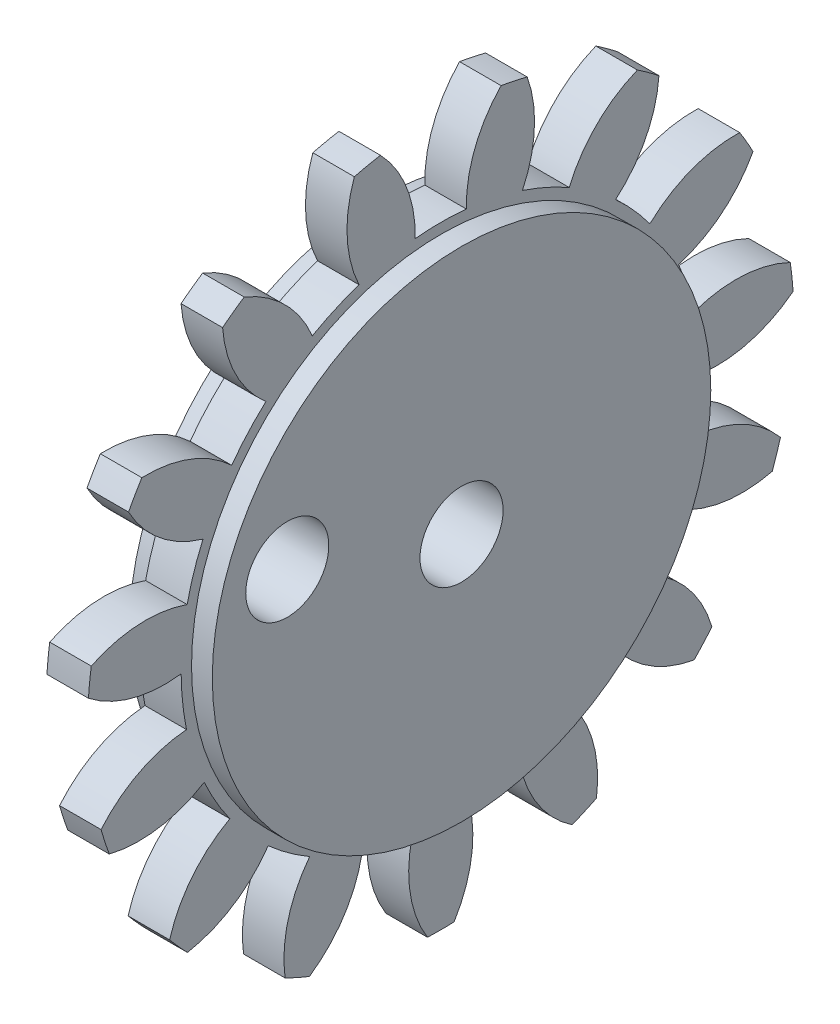
from build123d import *

# Parameters (mm, degrees)
BASPROSKE_W        = 6.35
BASPROSKE_H        = 53.975
TOOTHCUT_DEPTH     = 77.59584682
TEETHCUTS_COUNT    = 15
TEETHCUTS_ANGLE    = 336
HUBNEABOTSKE_R     = 38.1
HUBNEARBOTH_DEPTH  = 3.1750254
HUBFAR_START       = 3.1750254
HUBFARSKE_R        = 38.1
HUBFAR_DEPTH       = 3.1750254
BORSKE_R           = 6.35
BORE_DEPTH         = 12.7000508
SKETCH1_R          = 6.35
CUT_EXTRUDE1_DEPTH = 78.297193623
SCALE1_SCALE       = 0.75


with BuildPart() as part:
    # BasProSke → Base-Revolve (revolve)
    with BuildSketch(Plane(origin=(0, 0, 0), x_dir=(1, 0, 0), z_dir=(0, 1, 0))):
        with Locations((3.175, 26.9875)):
            Rectangle(BASPROSKE_W, BASPROSKE_H)
    revolve(axis=Axis((-10, 0, 0), (1, 0, 0)))

    # TooCutSke → ToothCut (cut, through all)
    with BuildSketch(Plane(origin=(0, 0, 0), x_dir=(0, 0, -1), z_dir=(1, 0, 0))):
        with BuildLine():
            ThreePointArc((3.91547882, 39.492605349), (0, 39.68623), (-3.91547882, 39.492605349))
            ThreePointArc((-3.91547882, 39.492605349), (-5.201686692, 46.882953453), (-9.241355572, 53.20376441))
            ThreePointArc((-9.241355572, 53.20376441), (0, 54.0004), (9.241355572, 53.20376441))
            ThreePointArc((9.241355572, 53.20376441), (5.201686692, 46.882953453), (3.91547882, 39.492605349))
        make_face()
    toothcut = extrude(amount=TOOTHCUT_DEPTH, mode=Mode.SUBTRACT)

    # TeethCuts: ToothCut ×15 about axis
    teethcuts_axis = Axis((-10, 0, 0), (1, 0, 0))
    for i in range(1, TEETHCUTS_COUNT):
        add(toothcut.rotate(teethcuts_axis, i * TEETHCUTS_ANGLE / (TEETHCUTS_COUNT - 1)), mode=Mode.SUBTRACT)

    # HubNeaBotSke → HubNearBoth (add)
    with BuildSketch(Plane.ZY):
        Circle(HUBNEABOTSKE_R)
    extrude(amount=HUBNEARBOTH_DEPTH)

    # HubFarSke → HubFar (add)
    with BuildSketch(Plane(origin=(6.35, 0, 0), x_dir=(0, 0, -1), z_dir=(1, 0, 0)).offset(HUBFAR_START)):
        Circle(HUBFARSKE_R)
    extrude(amount=-HUBFAR_DEPTH)

    # BorSke → Bore (cut, symmetric)
    with BuildSketch(Plane(origin=(0, 0, 0), x_dir=(0, 0, -1), z_dir=(1, 0, 0))):
        Circle(BORSKE_R)
    extrude(amount=BORE_DEPTH, both=True, mode=Mode.SUBTRACT)

    # Sketch1 → Cut-Extrude1 (cut, through all)
    with BuildSketch(Plane.ZY.offset(3.1750254)):
        with Locations((26.638896337, 8.655502106)):
            Circle(SKETCH1_R)
    extrude(amount=-CUT_EXTRUDE1_DEPTH, mode=Mode.SUBTRACT)


with BuildPart() as part_1:
    # Scale1: scaled about (3.175, -0.202804759, -0.624168867)
    add(part.part.scale(SCALE1_SCALE).moved(Location((0.79375, -0.05070119, -0.156042217))))


solid = part_1.part
